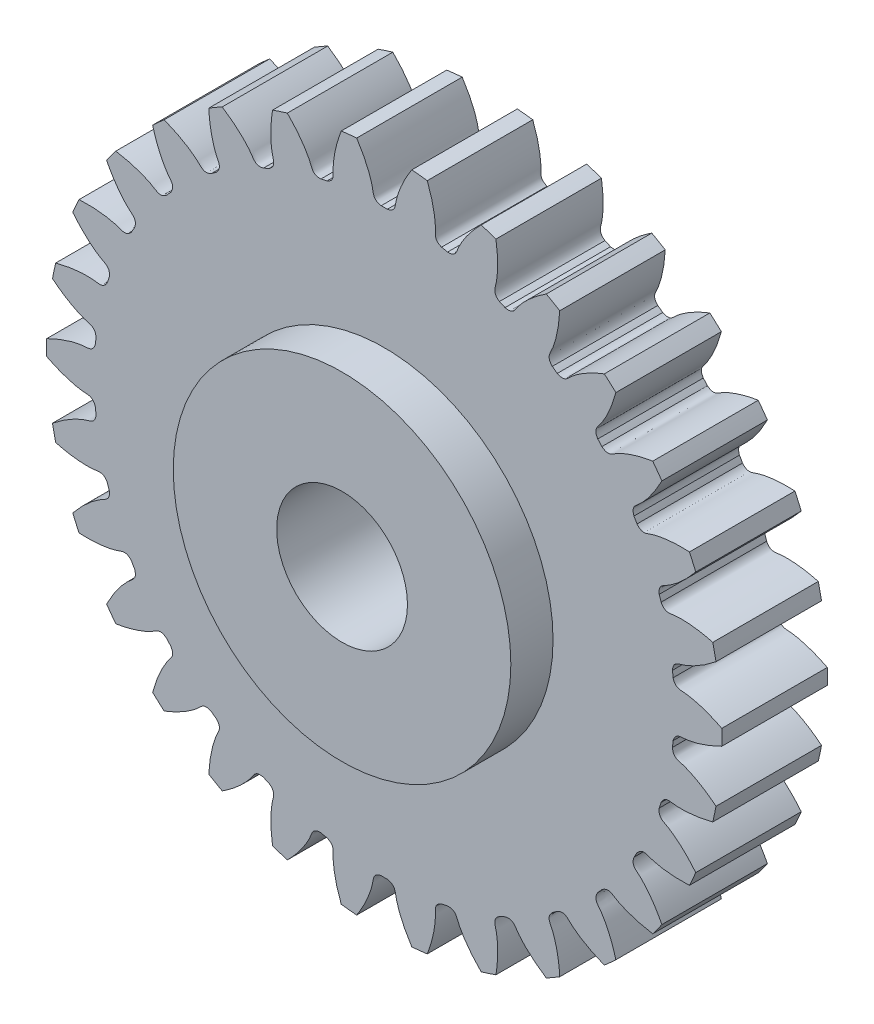
from build123d import *

# Parameters (mm, degrees)
SKETCH_1_R               = 8
EXTRUDE_1_DEPTH          = 2.5
CUT_EXTRUDE_1_DEPTH      = 12.586630226
PATTERN_CIRCULAR_1_COUNT = 30
SKETCH_5_R               = 4
EXTRUDE_2_DEPTH          = 1
EXTRUDE_START            = 1
SKETCH_6_R               = 4
EXTRUDE_3_DEPTH          = 1
CUT_EXTRUDE_2_REACH      = 17.325
CUT_EXTRUDE_START        = -3.5


with BuildPart() as part:
    # 草图1 → 凸台-拉伸1 (new body)
    with BuildSketch(Plane.XY):
        Circle(SKETCH_1_R)
    extrude(amount=EXTRUDE_1_DEPTH)

    # 草图2 → 切除-拉伸1 (cut, through all)
    with BuildSketch(Plane.XY):
        with BuildLine():
            ThreePointArc((0.072779314, 6.874614765), (0, 6.875), (-0.072779314, 6.874614765))
            add(Edge.make_bspline(
                [(-0.072779314, 6.874614765), (-0.254115345, 6.906487585), (-0.255152373, 7.023566318), (-0.27949241, 7.144289508), (-0.284975371, 7.169064619), (-0.291623543, 7.196462455), (-0.299533859, 7.226448996), (-0.308815312, 7.258982454), (-0.319571679, 7.294019257), (-0.331906756, 7.331512239), (-0.345922647, 7.37141123), (-0.361720171, 7.413662928), (-0.379398634, 7.458210975), (-0.399055788, 7.504995991), (-0.420787741, 7.553955613), (-0.444688876, 7.605024538), (-0.470851774, 7.658134564), (-0.499367135, 7.713214643), (-0.530323704, 7.770190925), (-0.563808189, 7.828986808), (-0.599905197, 7.889522992), (-0.638697148, 7.951717532), (-0.680264215, 8.015485894), (-0.724684248, 8.080741014), (-0.772032703, 8.147393354), (-0.822382582, 8.215350967), (-0.875804359, 8.284519558), (-0.932365919, 8.354802549), (-0.992132498, 8.426101145), (-1.055166616, 8.498314402), (-1.121528021, 8.571339295), (-1.191273632, 8.645070792), (-1.264457479, 8.719401924), (-1.341130655, 8.794223857), (-1.421341241, 8.869425973), (-1.534461933, 8.971310414), (-1.622672309, 9.046035766), (-1.683155916, 9.095279061)],
                knots=[0, 0, 0, 0, 0.115323882, 0.12341257, 0.132512303, 0.142623081, 0.153744905, 0.165877774, 0.179021689, 0.193176649, 0.208342655, 0.224519706, 0.241707802, 0.259906945, 0.279117132, 0.299338365, 0.320570644, 0.342813968, 0.366068337, 0.390333752, 0.415610213, 0.441897719, 0.46919627, 0.497505867, 0.52682651, 0.557158198, 0.588500931, 0.62085471, 0.654219534, 0.688595404, 0.723982319, 0.76038028, 0.797789286, 0.836209338, 0.875640435, 0.916082578, 1, 1, 1, 1], degree=3))
            ThreePointArc((-1.683155916, 9.095279061), (0, 9.249708917), (1.683155916, 9.095279061))
            add(Edge.make_bspline(
                [(0.072779314, 6.874614765), (0.254115345, 6.906487585), (0.255152373, 7.023566318), (0.27949241, 7.144289508), (0.284975371, 7.169064619), (0.291623543, 7.196462455), (0.299533859, 7.226448996), (0.308815312, 7.258982454), (0.319571679, 7.294019257), (0.331906756, 7.331512239), (0.345922647, 7.37141123), (0.361720171, 7.413662928), (0.379398634, 7.458210975), (0.399055788, 7.504995991), (0.420787741, 7.553955613), (0.444688876, 7.605024538), (0.470851774, 7.658134564), (0.499367135, 7.713214643), (0.530323704, 7.770190925), (0.563808189, 7.828986808), (0.599905197, 7.889522992), (0.638697148, 7.951717532), (0.680264215, 8.015485894), (0.724684248, 8.080741014), (0.772032703, 8.147393354), (0.822382582, 8.215350967), (0.875804359, 8.284519558), (0.932365919, 8.354802549), (0.992132498, 8.426101145), (1.055166616, 8.498314402), (1.121528021, 8.571339295), (1.191273632, 8.645070792), (1.264457479, 8.719401924), (1.341130655, 8.794223857), (1.421341241, 8.869425973), (1.534461933, 8.971310414), (1.622672309, 9.046035766), (1.683155916, 9.095279061)],
                knots=[0, 0, 0, 0, 0.115323882, 0.12341257, 0.132512303, 0.142623081, 0.153744905, 0.165877774, 0.179021689, 0.193176649, 0.208342655, 0.224519706, 0.241707802, 0.259906945, 0.279117132, 0.299338365, 0.320570644, 0.342813968, 0.366068337, 0.390333752, 0.415610213, 0.441897719, 0.46919627, 0.497505867, 0.52682651, 0.557158198, 0.588500931, 0.62085471, 0.654219534, 0.688595404, 0.723982319, 0.76038028, 0.797789286, 0.836209338, 0.875640435, 0.916082578, 1, 1, 1, 1], degree=3))
        make_face()
    cut_extrude_1 = extrude(amount=CUT_EXTRUDE_1_DEPTH, mode=Mode.SUBTRACT)

    # 阵列(圆周)1: 切除-拉伸1 ×30 about axis
    pattern_circular_1_axis = Axis((0, 0, -0.15), (0, 0, 1))
    for i in range(1, PATTERN_CIRCULAR_1_COUNT):
        add(cut_extrude_1.rotate(pattern_circular_1_axis, i * 360 / PATTERN_CIRCULAR_1_COUNT), mode=Mode.SUBTRACT)

    # 草图5 → 凸台-拉伸2 (add)
    with BuildSketch(Plane(origin=(0, 0, 0), x_dir=(-1, 0, 0), z_dir=(0, 0, -1))):
        Circle(SKETCH_5_R)
    extrude(amount=EXTRUDE_2_DEPTH)

    # 草图6 → 凸台-拉伸3 (add)
    with BuildSketch(Plane.XY.offset(2.5).offset(EXTRUDE_START)):
        Circle(SKETCH_6_R)
    extrude(amount=-EXTRUDE_3_DEPTH)

    # 草图4 → 切除-拉伸2 (cut, up to next)
    with BuildSketch(Plane(origin=(0, 0, 0), x_dir=(-1, 0, 0), z_dir=(0, 0, -1)).offset(CUT_EXTRUDE_START), mode=Mode.PRIVATE) as cut_extrude_2_sk1:
        with BuildLine():
            ThreePointArc((-0.775, 1.342339376), (0, -1.55), (0.775, 1.342339376))
            ThreePointArc((0.775, 1.342339376), (0, 1.55), (-0.775, 1.342339376))
        make_face()
    cut_extrude_2_tool1 = extrude(cut_extrude_2_sk1.sketch, amount=CUT_EXTRUDE_2_REACH, mode=Mode.PRIVATE) & part.part
    add(cut_extrude_2_tool1.solids().sort_by_distance((0, 0, 3.5))[0], mode=Mode.SUBTRACT)


solid = part.part
